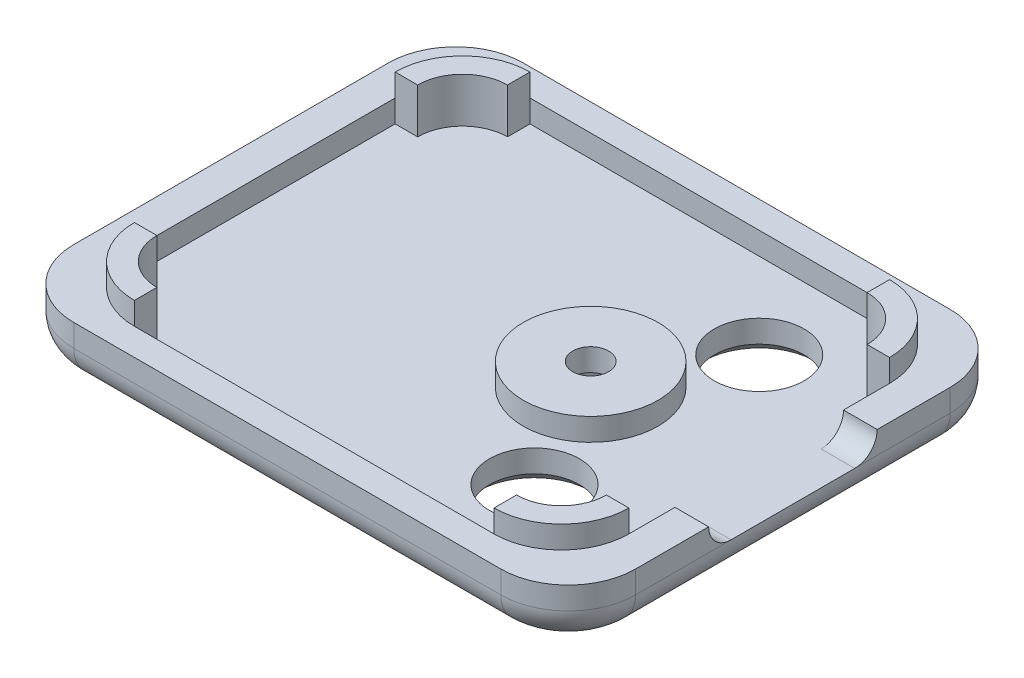
from build123d import *

# Parameters (mm, degrees)
SKETCH1_W           = 50
SKETCH1_H           = 40
SKETCH1_W_2         = 44
SKETCH1_H_2         = 35.2
BOSS_EXTRUDE1_DEPTH = 5
SKETCH2_W           = 44
SKETCH2_H           = 35.2
BOSS_EXTRUDE2_DEPTH = 3
SKETCH3_R           = 6
BOSS_EXTRUDE3_DEPTH = 2
SKETCH4_R           = 1.6
CUT_EXTRUDE1_DEPTH  = 5
FILLET1_R           = 6
FILLET2_R           = 3
CUT_EXTRUDE2_DEPTH  = 3
SKETCH8_R           = 4
CUT_EXTRUDE3_DEPTH  = 3
CHAMFER1_SIZE       = 1
SKETCH9_W           = 3
SKETCH9_H           = 15
CUT_EXTRUDE4_DEPTH  = 2
FILLET3_R           = 2
BOSS_EXTRUDE5_START = 4
BOSS_EXTRUDE5_DEPTH = 4
SKETCH11_R          = 4
CUT_EXTRUDE5_DEPTH  = 4


with BuildPart() as part:
    # Sketch1 → Boss-Extrude1 (new body)
    with BuildSketch(Plane(origin=(0, 0, 0), x_dir=(1, 0, 0), z_dir=(0, 1, 0))):
        Rectangle(SKETCH1_W, SKETCH1_H)
        Rectangle(SKETCH1_W_2, SKETCH1_H_2, mode=Mode.SUBTRACT)
    extrude(amount=BOSS_EXTRUDE1_DEPTH)

    # Sketch2 → Boss-Extrude2 (add)
    with BuildSketch(Plane(origin=(0, 0, 0), x_dir=(-1, 0, 0), z_dir=(0, -1, 0))):
        Rectangle(SKETCH2_W, SKETCH2_H)
    extrude(amount=-BOSS_EXTRUDE2_DEPTH)

    # Sketch3 → Boss-Extrude3 (add)
    with BuildSketch(Plane(origin=(0, 3, 0), x_dir=(1, 0, 0), z_dir=(0, 1, 0))):
        with Locations(Location((7, 0, 0), (0, 0, 270))):
            Circle(SKETCH3_R)
    extrude(amount=BOSS_EXTRUDE3_DEPTH)

    # Sketch4 → Cut-Extrude1 (cut)
    with BuildSketch(Plane(origin=(0, 5, 0), x_dir=(1, 0, 0), z_dir=(0, 1, 0))):
        with Locations(Location((7, 0, 0), (0, 0, 270))):
            Circle(SKETCH4_R)
    extrude(amount=-CUT_EXTRUDE1_DEPTH, mode=Mode.SUBTRACT)

    # Fillet1
    fillet1_edges = [part.edges().sort_by_distance(p)[0] for p in [
        (22, 4, 17.6),
        (22, 4, -17.6),
        (-22, 4, -17.6),
        (-22, 4, 17.6),
        (-25, 2.5, -20),
        (25, 2.5, -20),
        (25, 2.5, 20),
        (-25, 2.5, 20),
    ]]
    fillet(fillet1_edges, radius=FILLET1_R)

    # Fillet2
    fillet2_edges = [part.edges().sort_by_distance(p)[0] for p in [
        (-25, 0, 0),
        (0, 0, -20),
        (25, 0, 0),
        (0, 0, 20),
        (23.242640687, 0, -18.242640687),
        (23.242640687, 0, 18.242640687),
        (-23.242640687, 0, 18.242640687),
        (-23.242640687, 0, -18.242640687),
    ]]
    fillet(fillet2_edges, radius=FILLET2_R)

    # Sketch6 → Cut-Extrude2 (cut)
    with BuildSketch(Plane(origin=(0, 0, 0), x_dir=(-1, 0, 0), z_dir=(0, -1, 0))):
        Polygon((-3.75, 0), (-5.375, 2.814582562), (-8.625, 2.814582562), (-10.25, 0), (-8.625, -2.814582562), (-5.375, -2.814582562), align=None)
    extrude(amount=-CUT_EXTRUDE2_DEPTH, mode=Mode.SUBTRACT)

    # Sketch8 → Cut-Extrude3 (cut)
    with BuildSketch(Plane(origin=(0, 0, 0), x_dir=(-1, 0, 0), z_dir=(0, -1, 0))):
        with Locations(Location((-12, -10, 0), (0, 0, 90))):
            Circle(SKETCH8_R)
        with Locations(Location((-12, 10, 0), (0, 0, 90))):
            Circle(SKETCH8_R)
    extrude(amount=-CUT_EXTRUDE3_DEPTH, mode=Mode.SUBTRACT)

    # Chamfer1
    chamfer1_edges = [part.edges().sort_by_distance(p)[0] for p in [
        (12, 0, 14),
        (12, 0, -6),
    ]]
    chamfer(chamfer1_edges, length=CHAMFER1_SIZE)

    # Sketch9 → Cut-Extrude4 (cut)
    with BuildSketch(Plane(origin=(0, 5, 0), x_dir=(1, 0, 0), z_dir=(0, 1, 0))):
        with Locations((23.5, 0)):
            Rectangle(SKETCH9_W, SKETCH9_H)
    extrude(amount=-CUT_EXTRUDE4_DEPTH, mode=Mode.SUBTRACT)

    # Fillet3
    fillet3_edges = [part.edges().sort_by_distance(p)[0] for p in [
        (23.5, 3, -7.5),
        (23.5, 3, 7.5),
    ]]
    fillet(fillet3_edges, radius=FILLET3_R - 0.0001)  # a hair under: the kernel refuses the full size

    # Sketch10 → Boss-Extrude5 (add)
    with BuildSketch(Plane(origin=(0, 3, 0), x_dir=(1, 0, 0), z_dir=(0, 1, 0)).offset(BOSS_EXTRUDE5_START)):
        with BuildLine():
            Line((-16, -17.6), (-16, -11.6))
            Line((-16, -11.6), (-22, -11.6))
            ThreePointArc((-22, -11.6), (-20.242640687, -15.842640687), (-16, -17.6))
        make_face()
        with BuildLine():
            Line((-16, 17.6), (-16, 11.6))
            Line((-16, 11.6), (-22, 11.6))
            ThreePointArc((-22, 11.6), (-20.242640687, 15.842640687), (-16, 17.6))
        make_face()
        with BuildLine():
            Line((16, 17.6), (16, 11.6))
            Line((16, 11.6), (22, 11.6))
            ThreePointArc((22, 11.6), (20.242640687, 15.842640687), (16, 17.6))
        make_face()
        with BuildLine():
            Line((22, -11.6), (16, -11.6))
            Line((16, -11.6), (16, -17.6))
            ThreePointArc((16, -17.6), (20.242640687, -15.842640687), (22, -11.6))
        make_face()
    extrude(amount=-BOSS_EXTRUDE5_DEPTH)

    # Sketch11 → Cut-Extrude5 (cut)
    with BuildSketch(Plane(origin=(0, 7, 0), x_dir=(1, 0, 0), z_dir=(0, 1, 0))):
        with Locations((16, 11.6)):
            Circle(SKETCH11_R)
        with Locations((16, -11.6)):
            Circle(SKETCH11_R)
        with Locations((-16, -11.6)):
            Circle(SKETCH11_R)
        with Locations((-16, 11.6)):
            Circle(SKETCH11_R)
    extrude(amount=-CUT_EXTRUDE5_DEPTH, mode=Mode.SUBTRACT)


solid = part.part
